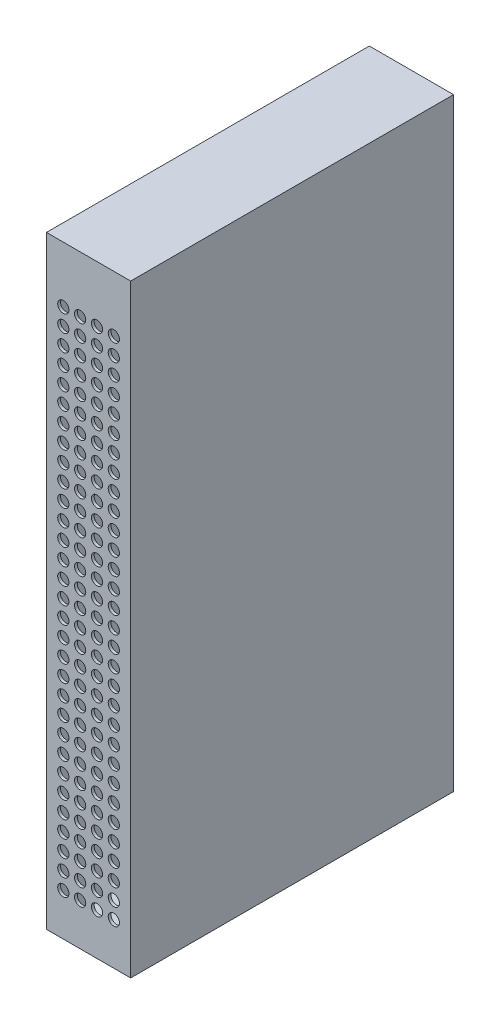
from build123d import *

# Parameters (mm, degrees)
SKETCH1_W         = 30
SKETCH1_H         = 215
CASE_2_DEPTH      = 115
CASE_SHELL_T      = 1
SKETCH2_R         = 2
PERFORATION_DEPTH = 1


with BuildPart() as part:
    # Sketch1 → Case 2 (new body)
    with BuildSketch(Plane.XY):
        with Locations((0, 107.5)):
            Rectangle(SKETCH1_W, SKETCH1_H)
    extrude(amount=CASE_2_DEPTH)

    # Case_shell (no face opened: a closed hollow body)
    add(offset(amount=-CASE_SHELL_T, mode=Mode.PRIVATE), mode=Mode.SUBTRACT)

    # Sketch2 → Perforation (cut)
    with BuildSketch(Plane.XY.offset(115)):
        with Locations((-9, 15)):
            Circle(SKETCH2_R)
        with Locations((-9, 21)):
            Circle(SKETCH2_R)
        with Locations((-9, 27)):
            Circle(SKETCH2_R)
        with Locations((-9, 33)):
            Circle(SKETCH2_R)
        with Locations((-9, 39)):
            Circle(SKETCH2_R)
        with Locations((-9, 45)):
            Circle(SKETCH2_R)
        with Locations((-9, 51)):
            Circle(SKETCH2_R)
        with Locations((-9, 57)):
            Circle(SKETCH2_R)
        with Locations((-9, 63)):
            Circle(SKETCH2_R)
        with Locations((-9, 69)):
            Circle(SKETCH2_R)
        with Locations((-9, 75)):
            Circle(SKETCH2_R)
        with Locations((-9, 81)):
            Circle(SKETCH2_R)
        with Locations((-9, 87)):
            Circle(SKETCH2_R)
        with Locations((-9, 93)):
            Circle(SKETCH2_R)
        with Locations((-9, 99)):
            Circle(SKETCH2_R)
        with Locations((-9, 105)):
            Circle(SKETCH2_R)
        with Locations((-9, 111)):
            Circle(SKETCH2_R)
        with Locations((-9, 117)):
            Circle(SKETCH2_R)
        with Locations((-9, 123)):
            Circle(SKETCH2_R)
        with Locations((-9, 129)):
            Circle(SKETCH2_R)
        with Locations((-9, 135)):
            Circle(SKETCH2_R)
        with Locations((-9, 141)):
            Circle(SKETCH2_R)
        with Locations((-9, 147)):
            Circle(SKETCH2_R)
        with Locations((-9, 153)):
            Circle(SKETCH2_R)
        with Locations((-9, 159)):
            Circle(SKETCH2_R)
        with Locations((-9, 165)):
            Circle(SKETCH2_R)
        with Locations((-9, 171)):
            Circle(SKETCH2_R)
        with Locations((-9, 177)):
            Circle(SKETCH2_R)
        with Locations((-9, 183)):
            Circle(SKETCH2_R)
        with Locations((-9, 189)):
            Circle(SKETCH2_R)
        with Locations((-9, 195)):
            Circle(SKETCH2_R)
        with Locations((-3, 15)):
            Circle(SKETCH2_R)
        with Locations((-3, 21)):
            Circle(SKETCH2_R)
        with Locations((-3, 27)):
            Circle(SKETCH2_R)
        with Locations((-3, 33)):
            Circle(SKETCH2_R)
        with Locations((-3, 39)):
            Circle(SKETCH2_R)
        with Locations((-3, 45)):
            Circle(SKETCH2_R)
        with Locations((-3, 51)):
            Circle(SKETCH2_R)
        with Locations((-3, 57)):
            Circle(SKETCH2_R)
        with Locations((-3, 63)):
            Circle(SKETCH2_R)
        with Locations((-3, 69)):
            Circle(SKETCH2_R)
        with Locations((-3, 75)):
            Circle(SKETCH2_R)
        with Locations((-3, 81)):
            Circle(SKETCH2_R)
        with Locations((-3, 87)):
            Circle(SKETCH2_R)
        with Locations((-3, 93)):
            Circle(SKETCH2_R)
        with Locations((-3, 99)):
            Circle(SKETCH2_R)
        with Locations((-3, 105)):
            Circle(SKETCH2_R)
        with Locations((-3, 111)):
            Circle(SKETCH2_R)
        with Locations((-3, 117)):
            Circle(SKETCH2_R)
        with Locations((-3, 123)):
            Circle(SKETCH2_R)
        with Locations((-3, 129)):
            Circle(SKETCH2_R)
        with Locations((-3, 135)):
            Circle(SKETCH2_R)
        with Locations((-3, 141)):
            Circle(SKETCH2_R)
        with Locations((-3, 147)):
            Circle(SKETCH2_R)
        with Locations((-3, 153)):
            Circle(SKETCH2_R)
        with Locations((-3, 159)):
            Circle(SKETCH2_R)
        with Locations((-3, 165)):
            Circle(SKETCH2_R)
        with Locations((-3, 171)):
            Circle(SKETCH2_R)
        with Locations((-3, 177)):
            Circle(SKETCH2_R)
        with Locations((-3, 183)):
            Circle(SKETCH2_R)
        with Locations((-3, 189)):
            Circle(SKETCH2_R)
        with Locations((-3, 195)):
            Circle(SKETCH2_R)
        with Locations((3, 15)):
            Circle(SKETCH2_R)
        with Locations((3, 21)):
            Circle(SKETCH2_R)
        with Locations((3, 27)):
            Circle(SKETCH2_R)
        with Locations((3, 33)):
            Circle(SKETCH2_R)
        with Locations((3, 39)):
            Circle(SKETCH2_R)
        with Locations((3, 45)):
            Circle(SKETCH2_R)
        with Locations((3, 51)):
            Circle(SKETCH2_R)
        with Locations((3, 57)):
            Circle(SKETCH2_R)
        with Locations((3, 63)):
            Circle(SKETCH2_R)
        with Locations((3, 69)):
            Circle(SKETCH2_R)
        with Locations((3, 75)):
            Circle(SKETCH2_R)
        with Locations((3, 81)):
            Circle(SKETCH2_R)
        with Locations((3, 87)):
            Circle(SKETCH2_R)
        with Locations((3, 93)):
            Circle(SKETCH2_R)
        with Locations((3, 99)):
            Circle(SKETCH2_R)
        with Locations((3, 105)):
            Circle(SKETCH2_R)
        with Locations((3, 111)):
            Circle(SKETCH2_R)
        with Locations((3, 117)):
            Circle(SKETCH2_R)
        with Locations((3, 123)):
            Circle(SKETCH2_R)
        with Locations((3, 129)):
            Circle(SKETCH2_R)
        with Locations((3, 135)):
            Circle(SKETCH2_R)
        with Locations((3, 141)):
            Circle(SKETCH2_R)
        with Locations((3, 147)):
            Circle(SKETCH2_R)
        with Locations((3, 153)):
            Circle(SKETCH2_R)
        with Locations((3, 159)):
            Circle(SKETCH2_R)
        with Locations((3, 165)):
            Circle(SKETCH2_R)
        with Locations((3, 171)):
            Circle(SKETCH2_R)
        with Locations((3, 177)):
            Circle(SKETCH2_R)
        with Locations((3, 183)):
            Circle(SKETCH2_R)
        with Locations((3, 189)):
            Circle(SKETCH2_R)
        with Locations((3, 195)):
            Circle(SKETCH2_R)
        with Locations((9, 15)):
            Circle(SKETCH2_R)
        with Locations((9, 21)):
            Circle(SKETCH2_R)
        with Locations((9, 27)):
            Circle(SKETCH2_R)
        with Locations((9, 33)):
            Circle(SKETCH2_R)
        with Locations((9, 39)):
            Circle(SKETCH2_R)
        with Locations((9, 45)):
            Circle(SKETCH2_R)
        with Locations((9, 51)):
            Circle(SKETCH2_R)
        with Locations((9, 57)):
            Circle(SKETCH2_R)
        with Locations((9, 63)):
            Circle(SKETCH2_R)
        with Locations((9, 69)):
            Circle(SKETCH2_R)
        with Locations((9, 75)):
            Circle(SKETCH2_R)
        with Locations((9, 81)):
            Circle(SKETCH2_R)
        with Locations((9, 87)):
            Circle(SKETCH2_R)
        with Locations((9, 93)):
            Circle(SKETCH2_R)
        with Locations((9, 99)):
            Circle(SKETCH2_R)
        with Locations((9, 105)):
            Circle(SKETCH2_R)
        with Locations((9, 111)):
            Circle(SKETCH2_R)
        with Locations((9, 117)):
            Circle(SKETCH2_R)
        with Locations((9, 123)):
            Circle(SKETCH2_R)
        with Locations((9, 129)):
            Circle(SKETCH2_R)
        with Locations((9, 135)):
            Circle(SKETCH2_R)
        with Locations((9, 141)):
            Circle(SKETCH2_R)
        with Locations((9, 147)):
            Circle(SKETCH2_R)
        with Locations((9, 153)):
            Circle(SKETCH2_R)
        with Locations((9, 159)):
            Circle(SKETCH2_R)
        with Locations((9, 165)):
            Circle(SKETCH2_R)
        with Locations((9, 171)):
            Circle(SKETCH2_R)
        with Locations((9, 177)):
            Circle(SKETCH2_R)
        with Locations((9, 183)):
            Circle(SKETCH2_R)
        with Locations((9, 189)):
            Circle(SKETCH2_R)
        with Locations((9, 195)):
            Circle(SKETCH2_R)
    extrude(amount=-PERFORATION_DEPTH, mode=Mode.SUBTRACT)


solid = part.part
